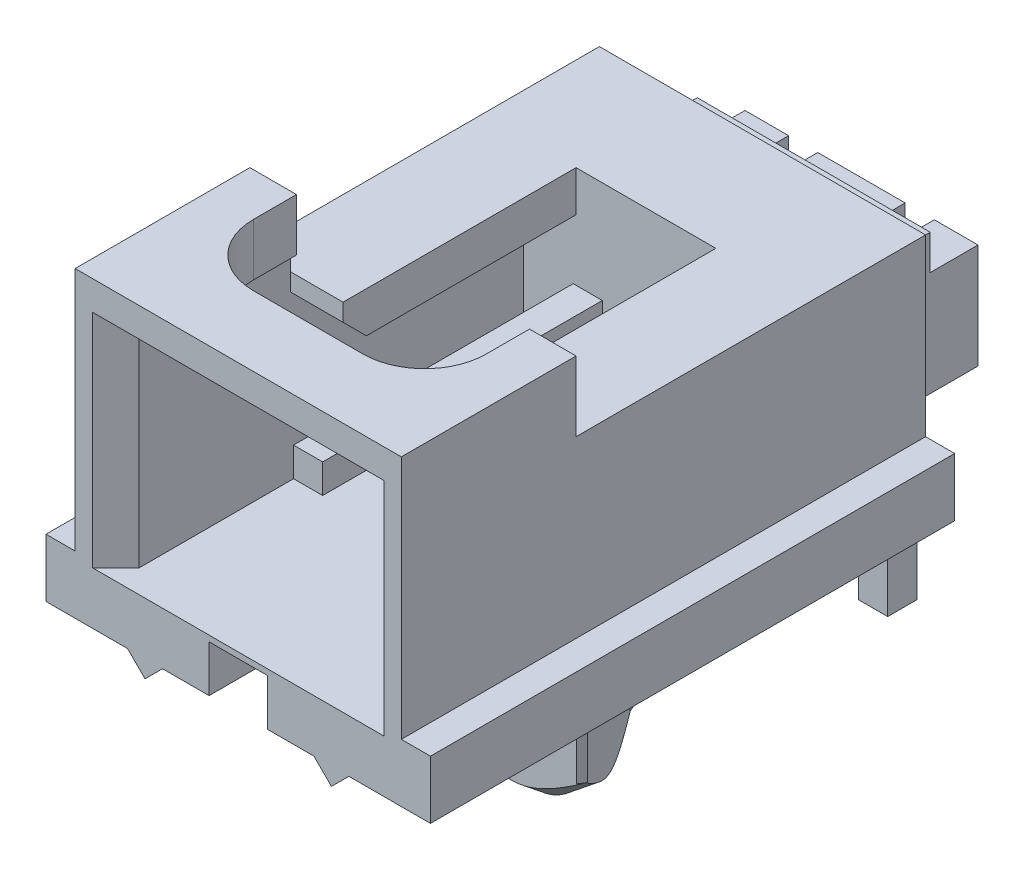
from build123d import *

# Parameters (mm, degrees)
DRAFT4_START         = -5.715
DRAFT4_DEPTH         = 11.43
DRAFT4_2_DEPTH       = 7.88162
DRAFT4_START_2       = -5.056452759
DRAFT4_3_DEPTH       = 2.516452759
SKETCH17_W           = 7.112
SKETCH17_H           = 11.43
BOSS_EXTRUDE13_DEPTH = 3.81
SKETCH18_W           = 5.08
SKETCH18_H           = 3.048
BOSS_EXTRUDE14_DEPTH = 1.1176
BOSS_EXTRUDE15_DEPTH = 0.635
BOSS_EXTRUDE16_DEPTH = 0.635
SKETCH28_W           = 0.635
SKETCH28_H           = 0.635
BOSS_EXTRUDE17_DEPTH = 5.2705
SKETCH34_W           = 0.635
SKETCH34_H           = 0.635
BOSS_EXTRUDE18_DEPTH = 5.2705
SKETCH41_W           = 0.9525
SKETCH41_H           = 2.286
BOSS_EXTRUDE19_DEPTH = 1.0414
SKETCH49_W           = 1.905
SKETCH49_H           = 2.286
BOSS_EXTRUDE20_DEPTH = 1.0414
SKETCH50_W           = 0.9525
SKETCH50_H           = 2.286
BOSS_EXTRUDE21_DEPTH = 1.0414
SKETCH51_W           = 5.334
SKETCH51_H           = 3.937
CUT_EXTRUDE5_DEPTH   = 3.809999999
BOSS_EXTRUDE22_DEPTH = 3.81
CUT_EXTRUDE6_DEPTH   = 5.08
SKETCH61_W           = 5.08
SKETCH61_H           = 1.143
CUT_EXTRUDE7_DEPTH   = 2.286
SKETCH62_W           = 1.27
SKETCH62_H           = 1.016
CUT_EXTRUDE8_DEPTH   = 8.89
SKETCH63_W           = 0.635
SKETCH63_H           = 0.635
BOSS_EXTRUDE23_DEPTH = 6.096
SKETCH64_W           = 0.635
SKETCH64_H           = 0.635
BOSS_EXTRUDE24_DEPTH = 6.096
CHAMFER4_SIZE        = 0.508
CHAMFER5_SIZE        = 0.508
CHAMFER6_SIZE        = 0.508
FILLET5_R            = 1.27
FILLET6_R            = 1.27
FILLET7_R            = 1.3462
FILLET8_R            = 1.3462


with BuildPart() as part:
    # Draft4: read off the stored shape, not the designer's step
    # Draft4 outline → Draft4 (new body)
    with BuildSketch(Plane.XY.offset(DRAFT4_START)):
        Polygon((2.032, -2.921), (2.413, -2.54), (4.191, -2.54), (4.191, -1.27), (-4.191, -1.27), (-4.191, -2.54), (-2.413, -2.54), (-2.032, -2.921), (-1.651000001, -2.54), (1.651000001, -2.54), align=None)
    extrude(amount=DRAFT4_DEPTH)

    # Draft4 2 outline → Draft4 2 (add)
    with BuildSketch(Plane.XY.offset(DRAFT4_START)):
        Polygon((-1.651, -3.302), (-1.651, -2.54), (-2.032, -2.921), align=None)
    extrude(amount=DRAFT4_2_DEPTH)

    # Draft4 3 outline → Draft4 3 (add)
    with BuildSketch(Plane(origin=(0, 0, 0), x_dir=(1, 0, 0), z_dir=(0, 1, 0)).offset(DRAFT4_START_2)):
        Polygon((4.0601462, -2.15818591), (3.998554473, -2.122625909), (2.6924, 0.1397), (2.6924, 0.21082), (2.6416, 0.21082), (2.6416, 0.1397), (1.335445527, -2.122625909), (1.2738538, -2.158185909), (1.360845527, -2.30886), (1.360845527, -2.16662), (3.973154473, -2.16662), (3.973154473, -2.30886), align=None)
        Polygon((-2.6416, 0.21082), (-2.6924, 0.21082), (-2.6924, 0.1397), (-3.998554473, -2.122625909), (-4.0601462, -2.15818591), (-3.973154473, -2.30886), (-3.973154473, -2.16662), (-1.360845527, -2.16662), (-1.360845527, -2.30886), (-1.2738538, -2.158185909), (-1.335445527, -2.122625909), (-2.6416, 0.1397), align=None)
    extrude(amount=DRAFT4_3_DEPTH)

    # Draft4 4 outline → Draft4 4 (revolve, cut)
    with BuildSketch(Plane(origin=(2.3964462, 0, 1.17602), x_dir=(1, 0, 0), z_dir=(0, 0, 1))):
        with BuildLine():
            Line((1.941480529, -3.605279542), (0.323285085, -4.940308286))
            ThreePointArc((0.323285085, -4.940308286), (0.171757667, -5.026535706), (0, -5.056452759))
            Line((0, -5.056452759), (1.941477645, -5.056452759))
            Line((1.941477645, -5.056452759), (1.941480529, -3.605279542))
        make_face()
    revolve(axis=Axis((2.3964462, 0, 1.17602), (0, 1, 0)), mode=Mode.SUBTRACT)

    # Draft4 5 outline → Draft4 5 (revolve, cut)
    with BuildSketch(Plane(origin=(-2.3964462, 0, 1.17602), x_dir=(1, 0, 0), z_dir=(0, 0, 1))):
        with BuildLine():
            Line((1.941480529, -3.605279577), (0.323285085, -4.940308286))
            ThreePointArc((0.323285085, -4.940308286), (0.171757667, -5.026535706), (0, -5.056452759))
            Line((0, -5.056452759), (1.941477645, -5.056452759))
            Line((1.941477645, -5.056452759), (1.941480529, -3.605279577))
        make_face()
    revolve(axis=Axis((-2.3964462, 0, 1.17602), (0, 1, 0)), mode=Mode.SUBTRACT)

    # Sketch17 → Boss-Extrude13 (add)
    with BuildSketch(Plane(origin=(0, -1.27, 0), x_dir=(-1, 0, 0), z_dir=(0, 1, 0))):
        Rectangle(SKETCH17_W, SKETCH17_H)
    extrude(amount=BOSS_EXTRUDE13_DEPTH)

    # Sketch18 → Boss-Extrude14 (add)
    with BuildSketch(Plane(origin=(0, 0, -5.715), x_dir=(-1, 0, 0), z_dir=(0, 0, -1))):
        Rectangle(SKETCH18_W, SKETCH18_H)
    extrude(amount=BOSS_EXTRUDE14_DEPTH)

    # Sketch22 → Boss-Extrude15 (add)
    with BuildSketch(Plane.ZY.offset(1.5875)):
        with BuildLine():
            Line((-6.8326, -0.7747), (-6.8326, 0.16163098))
            Line((-6.8326, 0.16163098), (-7.493, 0.16163098))
            Line((-7.493, 0.16163098), (-7.493, -0.9525))
            Line((-7.493, -0.9525), (-6.858, -0.9525))
            ThreePointArc((-6.858, -0.9525), (-6.851617929, -0.862697439), (-6.8326, -0.7747))
        make_face()
    extrude(amount=-BOSS_EXTRUDE15_DEPTH)

    # Sketch27 → Boss-Extrude16 (add)
    with BuildSketch(Plane.ZY.offset(-0.9525)):
        with BuildLine():
            Line((-6.8326, -0.7747), (-6.8326, 0.16163098))
            Line((-6.8326, 0.16163098), (-7.493, 0.16163098))
            Line((-7.493, 0.16163098), (-7.493, -0.9525))
            Line((-7.493, -0.9525), (-6.858, -0.9525))
            ThreePointArc((-6.858, -0.9525), (-6.851617929, -0.862697439), (-6.8326, -0.7747))
        make_face()
    extrude(amount=-BOSS_EXTRUDE16_DEPTH)

    # Sketch28 → Boss-Extrude17 (add)
    with BuildSketch(Plane.XZ.offset(0.9525)):
        with Locations((-1.27, -7.1755)):
            Rectangle(SKETCH28_W, SKETCH28_H)
    extrude(amount=BOSS_EXTRUDE17_DEPTH)

    # Sketch34 → Boss-Extrude18 (add)
    with BuildSketch(Plane(origin=(0, -0.9525, 0), x_dir=(-1, 0, 0), z_dir=(0, -1, 0))):
        with Locations((-1.27, 7.1755)):
            Rectangle(SKETCH34_W, SKETCH34_H)
    extrude(amount=BOSS_EXTRUDE18_DEPTH)

    # Sketch41 → Boss-Extrude19 (add)
    with BuildSketch(Plane(origin=(0, 0, -7.874), x_dir=(-1, 0, 0), z_dir=(0, 0, -1))):
        with Locations((2.06375, -0.381)):
            Rectangle(SKETCH41_W, SKETCH41_H)
    extrude(amount=-BOSS_EXTRUDE19_DEPTH)

    # Sketch49 → Boss-Extrude20 (add)
    with BuildSketch(Plane(origin=(0, 0, -7.874), x_dir=(-1, 0, 0), z_dir=(0, 0, -1))):
        with Locations((0, -0.381)):
            Rectangle(SKETCH49_W, SKETCH49_H)
    extrude(amount=-BOSS_EXTRUDE20_DEPTH)

    # Sketch50 → Boss-Extrude21 (add)
    with BuildSketch(Plane(origin=(0, 0, -7.874), x_dir=(-1, 0, 0), z_dir=(0, 0, -1))):
        with Locations((-2.06375, -0.381)):
            Rectangle(SKETCH50_W, SKETCH50_H)
    extrude(amount=-BOSS_EXTRUDE21_DEPTH)

    # Sketch51 → Cut-Extrude5 (cut)
    with BuildSketch(Plane.XY.offset(5.715)):
        with Locations((0, 0.5715)):
            Rectangle(SKETCH51_W, SKETCH51_H)
    extrude(amount=-CUT_EXTRUDE5_DEPTH, mode=Mode.SUBTRACT)

    # Sketch59 → Boss-Extrude22 (add)
    with BuildSketch(Plane.XY.offset(5.715)):
        Polygon((3.556, 4.064), (-3.556, 4.064), (-3.556, 2.54), (-2.667, 2.54), (-2.667, 2.921), (2.667, 2.921), (2.667, 2.54), (3.556, 2.54), align=None)
    extrude(amount=-BOSS_EXTRUDE22_DEPTH)

    # Sketch60 → Cut-Extrude6 (cut)
    with BuildSketch(Plane.XY.offset(1.905000001)):
        Polygon((-1.524, 2.54), (-1.524, 1.651), (-2.667, 1.651), (-2.667, -1.397), (2.667, -1.397), (2.667, 1.651), (1.524, 1.651), (1.524, 2.54), align=None)
    extrude(amount=-CUT_EXTRUDE6_DEPTH, mode=Mode.SUBTRACT)

    # Sketch61 → Cut-Extrude7 (cut)
    with BuildSketch(Plane(origin=(0, 0, 1.905), x_dir=(-1, 0, 0), z_dir=(0, 0, -1))):
        with Locations((0, 3.4925)):
            Rectangle(SKETCH61_W, SKETCH61_H)
    extrude(amount=-CUT_EXTRUDE7_DEPTH, mode=Mode.SUBTRACT)

    # Sketch62 → Cut-Extrude8 (cut)
    with BuildSketch(Plane.XY.offset(5.715)):
        with Locations((0, -2.032)):
            Rectangle(SKETCH62_W, SKETCH62_H)
    extrude(amount=-CUT_EXTRUDE8_DEPTH, mode=Mode.SUBTRACT)

    # Sketch63 → Boss-Extrude23 (add)
    with BuildSketch(Plane.XY.offset(-3.175)):
        with Locations((1.27, 0)):
            Rectangle(SKETCH63_W, SKETCH63_H)
    extrude(amount=BOSS_EXTRUDE23_DEPTH)

    # Sketch64 → Boss-Extrude24 (add)
    with BuildSketch(Plane.XY.offset(-3.175)):
        with Locations((-1.27, 0)):
            Rectangle(SKETCH64_W, SKETCH64_H)
    extrude(amount=BOSS_EXTRUDE24_DEPTH)

    # Chamfer4
    chamfer4_edges = [part.edges().sort_by_distance(p)[0] for p in [
        (-2.0955, 1.651, 1.905000001),
    ]]
    chamfer(chamfer4_edges, length=CHAMFER4_SIZE)

    # Chamfer5
    chamfer5_edges = [part.edges().sort_by_distance(p)[0] for p in [
        (2.0955, 1.651, 1.905000001),
    ]]
    chamfer(chamfer5_edges, length=CHAMFER5_SIZE)

    # Chamfer6
    chamfer6_edges = [part.edges().sort_by_distance(p)[0] for p in [
        (2.667, 0.5715, 5.715),
        (-2.667, 0.762, 5.715),
        (0, 2.921, 5.715),
    ]]
    chamfer(chamfer6_edges, length=CHAMFER6_SIZE)

    # Fillet5
    # the kernel refuses this fillet: 1.27 mm, written as the material it takes off along each edge
    with BuildSketch(Plane(origin=(-1.5875, 0.16163098, -7.493), x_dir=(0, 0, 1), z_dir=(1, 0, 0))) as fillet5_piece_1:
        with BuildLine():
            CenterArc((1.27, 1.11413098), FILLET5_R, 180, 61.314597986)
            Line((0, 1.11413098), (0, 0))
            Line((0, 0), (0.6604, 0))
        make_face()
    extrude(amount=0.635, mode=Mode.SUBTRACT)

    # Fillet6
    # the kernel refuses this fillet: 1.27 mm, written as the material it takes off along each edge
    with BuildSketch(Plane(origin=(0.9525, 0.16163098, -7.493), x_dir=(0, -1, 0), z_dir=(1, 0, 0))) as fillet6_piece_1:
        with BuildLine():
            CenterArc((1.11413098, -1.27), FILLET6_R, 90, 61.314597992)
            Line((0, -0.6604), (0, 0))
            Line((0, 0), (1.11413098, 0))
        make_face()
    extrude(amount=0.635, mode=Mode.SUBTRACT)

    # Fillet7
    fillet7_edges = [part.edges().sort_by_distance(p)[0] for p in [
        (-2.54, 3.4925, 4.191),
    ]]
    fillet(fillet7_edges, radius=FILLET7_R)

    # Fillet8
    fillet8_edges = [part.edges().sort_by_distance(p)[0] for p in [
        (2.54, 3.4925, 4.191),
    ]]
    fillet(fillet8_edges, radius=FILLET8_R)


solid = part.part
